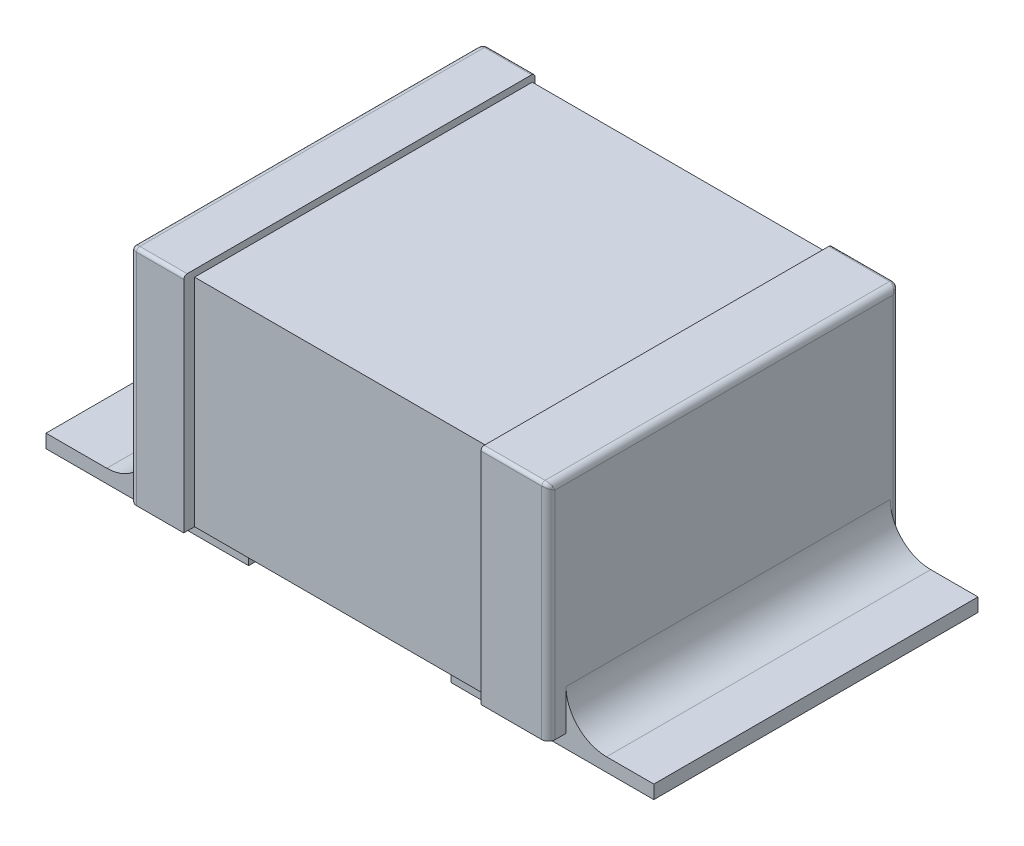
from build123d import *

# Parameters (mm, degrees)
SKETCH1_W           = 2.5
SKETCH1_H           = 1.6
BOSS_EXTRUDE1_DEPTH = 1.1
BOSS_EXTRUDE2_DEPTH = 0.5
BOSS_EXTRUDE3_START = 0.4
BOSS_EXTRUDE3_DEPTH = 0.4
SKETCH6_W           = 1.5
SKETCH6_H           = 2.4
BOSS_EXTRUDE4_DEPTH = 0.1
FILLET3_R           = 0.05
FILLET4_R           = 0.3


with BuildPart() as part:
    # Sketch1 → Boss-Extrude1 (new, symmetric)
    with BuildSketch(Plane(origin=(0, 0, 0), x_dir=(0, 0, -1), z_dir=(1, 0, 0))):
        with Locations((0, 0.9)):
            Rectangle(SKETCH1_W, SKETCH1_H)
    extrude(amount=BOSS_EXTRUDE1_DEPTH, both=True)

    # Sketch3 → Boss-Extrude2 (add)
    with BuildSketch(Plane(origin=(1.1, 0, 0), x_dir=(0, 0, -1), z_dir=(1, 0, 0))):
        with BuildLine():
            Line((-1.305, 1.75), (1.245, 1.75))
            ThreePointArc((1.245, 1.75), (1.26267767, 1.74267767), (1.27, 1.725))
            Line((1.27, 1.725), (1.27, 0.1))
            Line((1.27, 0.1), (-1.33, 0.1))
            Line((-1.33, 0.1), (-1.33, 1.725))
            ThreePointArc((-1.33, 1.725), (-1.32267767, 1.74267767), (-1.305, 1.75))
        make_face()
    extrude(amount=BOSS_EXTRUDE2_DEPTH)

    # Sketch5 → Boss-Extrude3 (add)
    with BuildSketch(Plane.ZY.offset(1.1).offset(BOSS_EXTRUDE3_START)):
        with BuildLine():
            Line((-1.245, 1.75), (1.305, 1.75))
            ThreePointArc((1.305, 1.75), (1.32267767, 1.74267767), (1.33, 1.725))
            Line((1.33, 1.725), (1.33, 0.1))
            Line((1.33, 0.1), (-1.27, 0.1))
            Line((-1.27, 0.1), (-1.27, 1.725))
            ThreePointArc((-1.27, 1.725), (-1.26267767, 1.74267767), (-1.245, 1.75))
        make_face()
    extrude(amount=-BOSS_EXTRUDE3_DEPTH)

    # Sketch6 → Boss-Extrude4 (add)
    with BuildSketch(Plane(origin=(0, 0, 0), x_dir=(1, 0, 0), z_dir=(0, 1, 0))):
        with Locations((-1.5, 0)):
            Rectangle(SKETCH6_W, SKETCH6_H)
        with Locations((1.5, 0)):
            Rectangle(SKETCH6_W, SKETCH6_H)
    extrude(amount=BOSS_EXTRUDE4_DEPTH)

    # Fillet3
    fillet3_edges = [part.edges().sort_by_distance(p)[0] for p in [
        (1.6, 0.9125, 1.33),
        (1.6, 1.74267767, 1.32267767),
        (1.6, 1.75, 0.03),
        (1.6, 1.74267767, -1.26267767),
        (-1.5, 0.9125, 1.33),
        (-1.5, 1.74267767, 1.32267767),
        (-1.5, 1.75, 0.03),
        (-1.5, 1.74267767, -1.26267767),
        (1.6, 0.9125, -1.27),
        (-1.5, 0.9125, -1.27),
    ]]
    fillet(fillet3_edges, radius=FILLET3_R)

    # Fillet4
    fillet4_edges = [part.edges().sort_by_distance(p)[0] for p in [
        (1.6, 0.1, 0),
        (-1.5, 0.1, 0),
    ]]
    fillet(fillet4_edges, radius=FILLET4_R)


solid = part.part
